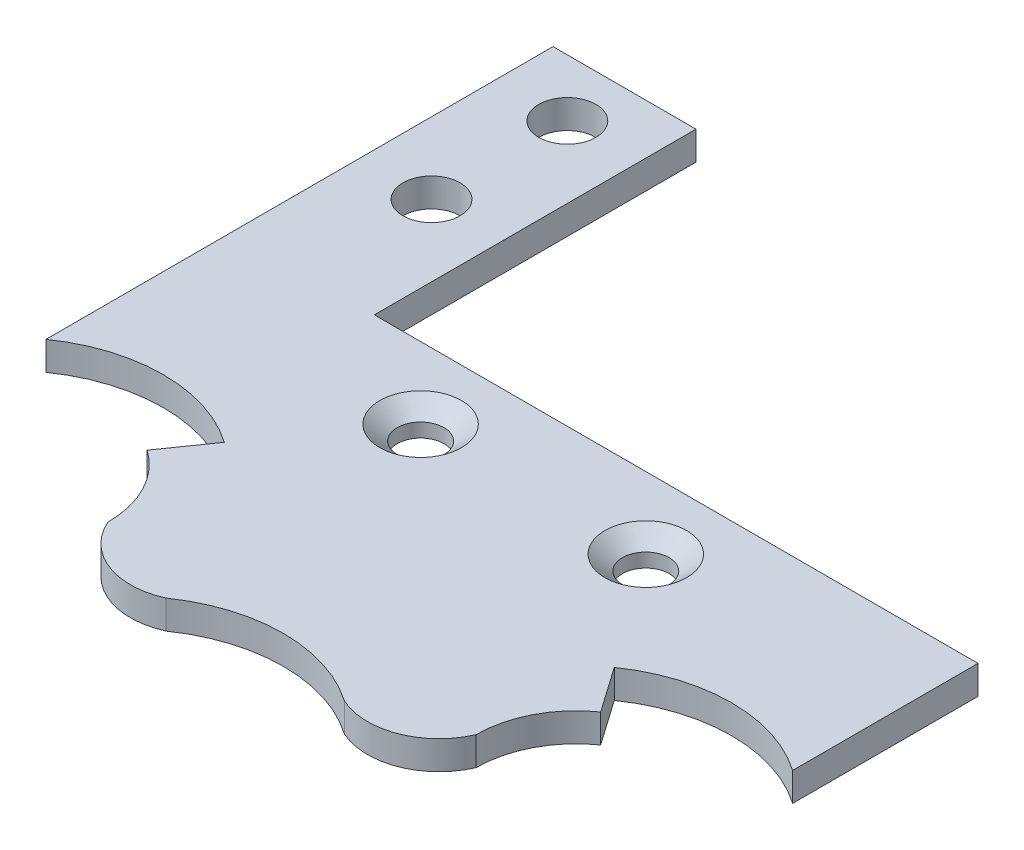
from build123d import *

# Parameters (mm, degrees)
BOSS_EXTRUDE1_DEPTH                               = 3
CONVERT_SOLID1_DEPTH                              = 1
SKETCH8_R                                         = 2
CUT_EXTRUDE1_DEPTH                                = 2
CSK_FOR_4_FLAT_HEAD_MACHINE_SCREW_100_D           = 3.2639
CSK_FOR_4_FLAT_HEAD_MACHINE_SCREW_100_DEPTH       = 2
CSK_FOR_4_FLAT_HEAD_MACHINE_SCREW_100_CSINK_D     = 5.715
CSK_FOR_4_FLAT_HEAD_MACHINE_SCREW_100_CSINK_ANGLE = 100
CSK_FOR_4_FLAT_HEAD_MACHINE_SCREW_100_TIP         = 0.980574487


# Read off the part's stored shape, not the designer's step: Convert-Solid1
with BuildPart() as part:
    # Sketch2 → Boss-Extrude1 (new body)
    with BuildSketch(Plane(origin=(0, 0, 0), x_dir=(1, 0, 0), z_dir=(0, 1, 0))):
        with BuildLine():
            Line((-15.860247962, 17.20906431), (-13.637639272, 20.383278482))
            ThreePointArc((-13.637639272, 20.383278482), (-19.875283017, 22.35), (-26.112926762, 20.383278482))
            Line((-26.112926762, 20.383278482), (-26.112926762, 33.35))
            Line((-26.112926762, 33.35), (-26.112926762, 55.85))
            Line((-26.112926762, 55.85), (-16.112926762, 55.85))
            Line((-16.112926762, 55.85), (-16.112926762, 33.35))
            Line((-16.112926762, 33.35), (26.112926762, 33.35))
            Line((26.112926762, 33.35), (26.112926762, 20.383278482))
            ThreePointArc((26.112926762, 20.383278482), (19.875283017, 22.35), (13.637639272, 20.383278482))
            Line((13.637639272, 20.383278482), (15.860247962, 17.20906431))
            ThreePointArc((15.860247962, 17.20906431), (13.666207185, 14.707240293), (12.875283017, 11.475))
            ThreePointArc((12.875283017, 11.475), (10.092914311, 8.804356775), (6.237643745, 8.908278482))
            ThreePointArc((6.237643745, 8.908278482), (0, 10.875), (-6.237643745, 8.908278482))
            ThreePointArc((-6.237643745, 8.908278482), (-10.092914311, 8.804356775), (-12.875283017, 11.475))
            ThreePointArc((-12.875283017, 11.475), (-13.666207185, 14.707240293), (-15.860247962, 17.20906431))
        make_face()
    extrude(amount=BOSS_EXTRUDE1_DEPTH)

    # Convert-Solid1 outline → Convert-Solid1 (cut)
    with BuildSketch(Plane(origin=(0, 0, 0), x_dir=(1, 0, 0), z_dir=(0, 1, 0))):
        with BuildLine():
            Line((-26.112926762, 55.85), (-26.112926762, 20.383278482))
            ThreePointArc((-26.112926762, 20.383278482), (-19.875283017, 22.35), (-13.637639272, 20.383278482))
            Line((-13.637639272, 20.383278482), (-15.860247962, 17.20906431))
            ThreePointArc((-15.860247962, 17.20906431), (-13.666207185, 14.707240292), (-12.875283017, 11.475))
            ThreePointArc((-12.875283017, 11.475), (-10.092914311, 8.804356775), (-6.237643745, 8.908278482))
            ThreePointArc((-6.237643745, 8.908278482), (0, 10.875), (6.237643745, 8.908278482))
            ThreePointArc((6.237643745, 8.908278482), (10.092914311, 8.804356775), (12.875283017, 11.475))
            ThreePointArc((12.875283017, 11.475), (13.666207185, 14.707240292), (15.860247962, 17.20906431))
            Line((15.860247962, 17.20906431), (13.637639272, 20.383278482))
            ThreePointArc((13.637639272, 20.383278482), (19.875283017, 22.35), (26.112926762, 20.383278482))
            Line((26.112926762, 20.383278482), (26.112926762, 33.35))
            Line((26.112926762, 33.35), (-16.112926762, 33.35))
            Line((-16.112926762, 33.35), (-16.112926762, 55.85))
            Line((-16.112926762, 55.85), (-26.112926762, 55.85))
        make_face()
    extrude(amount=CONVERT_SOLID1_DEPTH, mode=Mode.SUBTRACT)

    # Sketch8 → Cut-Extrude1 (cut)
    with BuildSketch(Plane(origin=(0, 3, 0), x_dir=(1, 0, 0), z_dir=(0, 1, 0))):
        with Locations(Location((-21.112926762, 51.85, 0), (0, 0, 270))):
            Circle(SKETCH8_R)
        with Locations(Location((-21.112926762, 42.35, 0), (0, 0, 270))):
            Circle(SKETCH8_R)
    extrude(amount=-CUT_EXTRUDE1_DEPTH, mode=Mode.SUBTRACT)

    # CSK for #4 Flat Head Machine Screw (100)1
    with Locations(Plane(origin=(0, 3, 0), x_dir=(1, 0, 0), z_dir=(0, 1, 0))):
        with Locations((7.875283017, 28.35), (-7.875283017, 28.35)):
            CounterSinkHole(CSK_FOR_4_FLAT_HEAD_MACHINE_SCREW_100_D / 2, CSK_FOR_4_FLAT_HEAD_MACHINE_SCREW_100_CSINK_D / 2, depth=CSK_FOR_4_FLAT_HEAD_MACHINE_SCREW_100_DEPTH, counter_sink_angle=CSK_FOR_4_FLAT_HEAD_MACHINE_SCREW_100_CSINK_ANGLE)
            with Locations((0, 0, -(CSK_FOR_4_FLAT_HEAD_MACHINE_SCREW_100_DEPTH + CSK_FOR_4_FLAT_HEAD_MACHINE_SCREW_100_TIP / 2))):  # 118° drill point
                Cone(0, CSK_FOR_4_FLAT_HEAD_MACHINE_SCREW_100_D / 2, CSK_FOR_4_FLAT_HEAD_MACHINE_SCREW_100_TIP, mode=Mode.SUBTRACT)


solid = part.part
